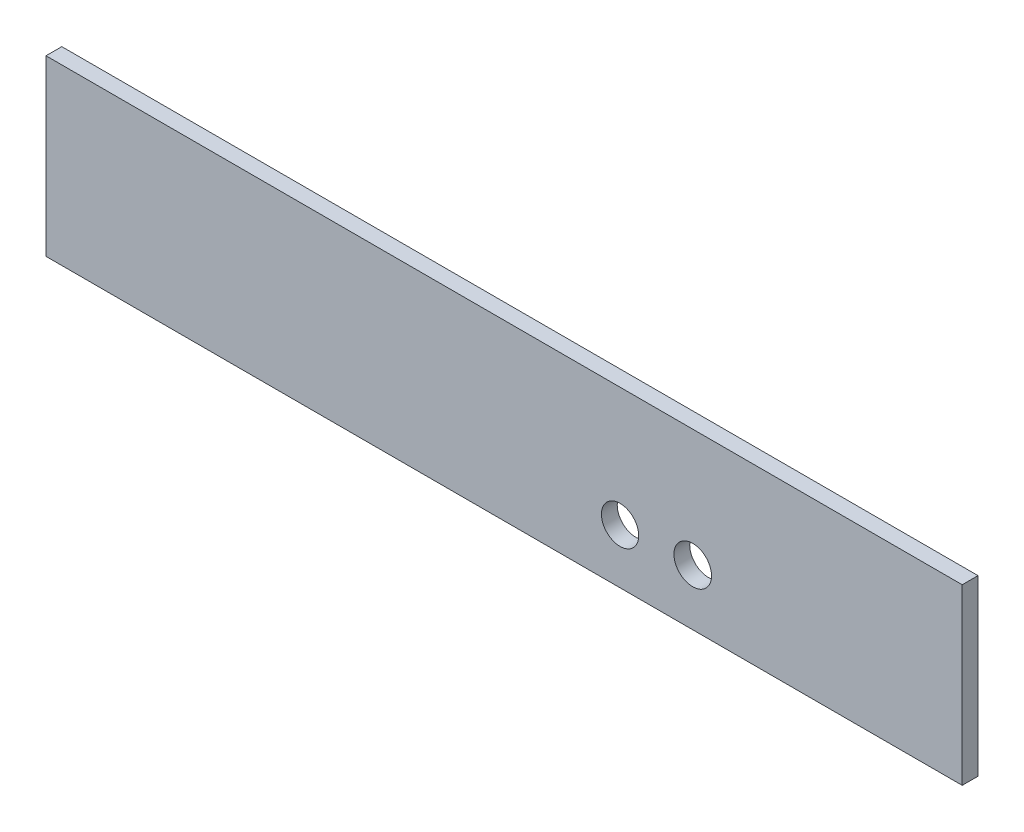
from build123d import *

# Parameters (mm, degrees)
ESQUISSE1_W             = 580
ESQUISSE1_H             = 110
BOSS_EXTRU_1_DEPTH      = 10
ESQUISSE2_R             = 11.8
ESQUISSE2_R_2           = 11.9
ENL_V_MAT_EXTRU_1_DEPTH = 10


with BuildPart() as part:
    # Esquisse1 → Boss.-Extru.1 (new body)
    with BuildSketch(Plane.XY):
        with Locations((290, 55)):
            Rectangle(ESQUISSE1_W, ESQUISSE1_H)
    extrude(amount=BOSS_EXTRU_1_DEPTH)

    # Esquisse2 → Enlèv. mat.-Extru.1 (cut)
    with BuildSketch(Plane(origin=(0, 0, 0), x_dir=(-1, 0, 0), z_dir=(0, 0, -1))):
        with Locations((-363.409437581, 34.5)):
            Circle(ESQUISSE2_R)
        with Locations((-409.409437581, 35.5)):
            Circle(ESQUISSE2_R_2)
    extrude(amount=-ENL_V_MAT_EXTRU_1_DEPTH, mode=Mode.SUBTRACT)


solid = part.part
